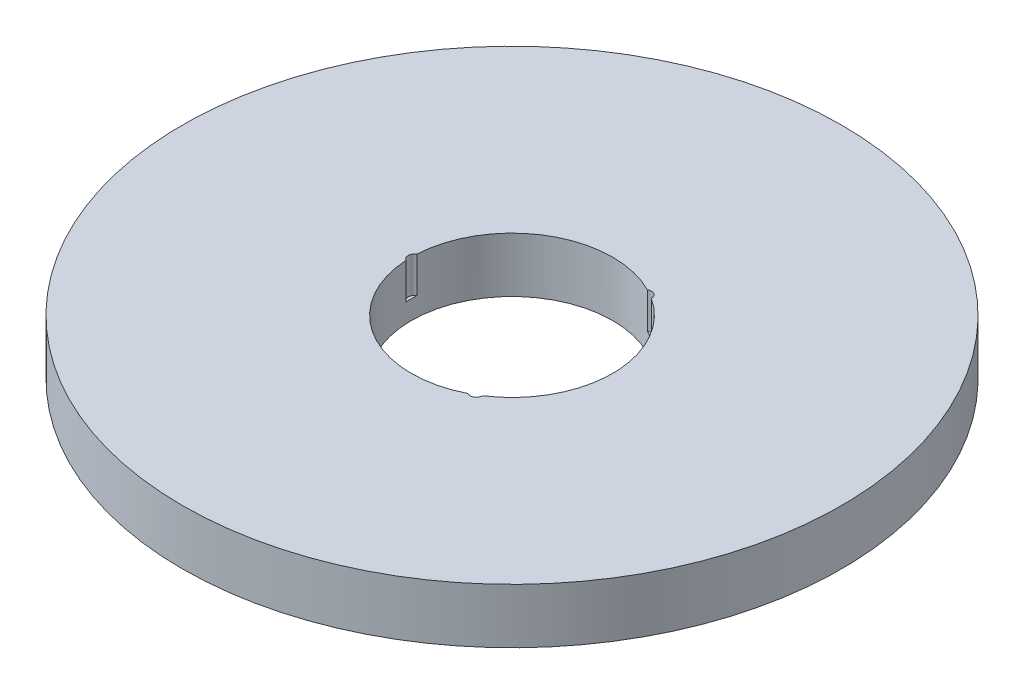
from build123d import *

# Parameters (mm, degrees)
SKETCH1_R           = 90
BOSS_EXTRUDE1_DEPTH = 15
SKETCH2_R           = 27.5
CUT_EXTRUDE1_DEPTH  = 129.16005618
SKETCH3_R           = 1.711382177
CUT_EXTRUDE2_DEPTH  = 9.82853876
CIRPATTERN1_COUNT   = 3


with BuildPart() as part:
    # Sketch1 → Boss-Extrude1 (new body)
    with BuildSketch(Plane(origin=(0, 0, 0), x_dir=(1, 0, 0), z_dir=(0, 1, 0))):
        Circle(SKETCH1_R)
    extrude(amount=BOSS_EXTRUDE1_DEPTH)

    # Sketch2 → Cut-Extrude1 (cut, through all)
    with BuildSketch(Plane(origin=(0, 0, 0), x_dir=(1, 0, 0), z_dir=(0, 1, 0))):
        Circle(SKETCH2_R)
    extrude(amount=CUT_EXTRUDE1_DEPTH, mode=Mode.SUBTRACT)

    # Sketch3 → Cut-Extrude2 (cut)
    with BuildSketch(Plane(origin=(0, 15, 0), x_dir=(1, 0, 0), z_dir=(0, 1, 0))):
        with Locations((-26.613387822, 0)):
            Circle(SKETCH3_R)
    cut_extrude2 = extrude(amount=-CUT_EXTRUDE2_DEPTH, mode=Mode.SUBTRACT)

    # CirPattern1: Cut-Extrude2 ×3 about axis
    cirpattern1_axis = Axis((0, 0, 0), (0, 1, 0))
    for i in range(1, CIRPATTERN1_COUNT):
        add(cut_extrude2.rotate(cirpattern1_axis, i * 360 / CIRPATTERN1_COUNT), mode=Mode.SUBTRACT)


solid = part.part
